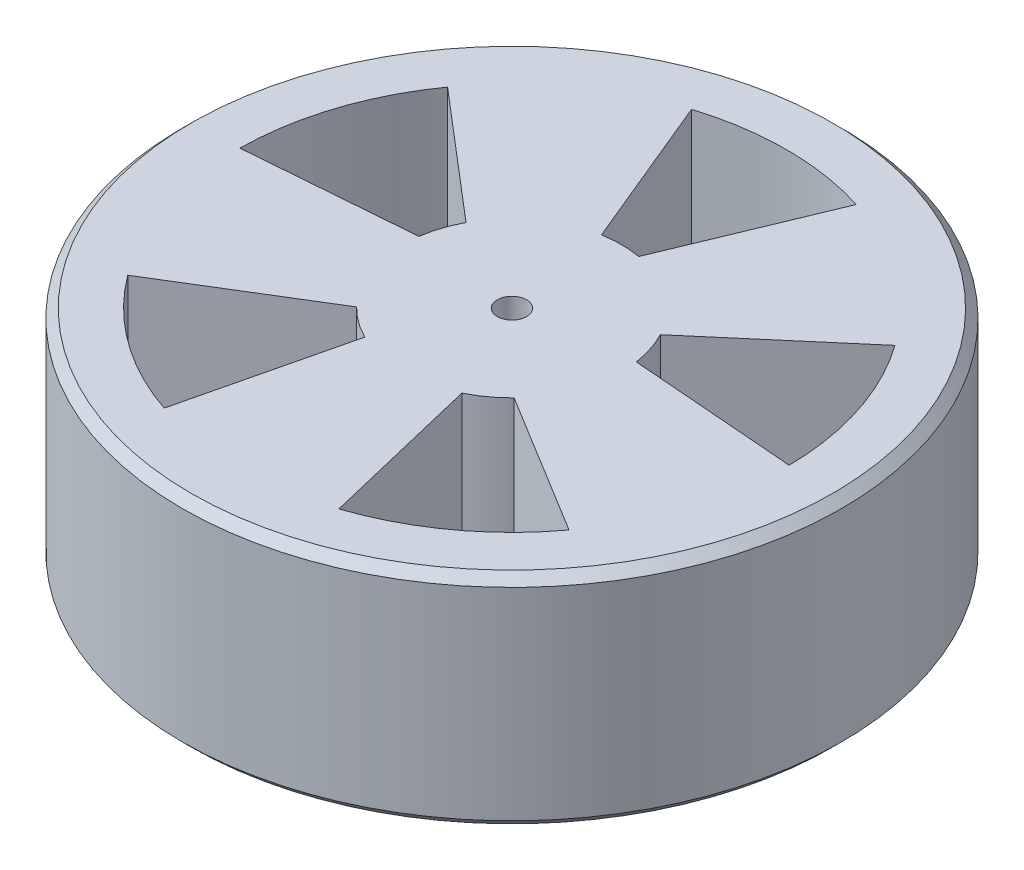
from build123d import *

# Parameters (mm, degrees)
SKETCH1_R               = 76.2
BOSS_EXTRUDE1_DEPTH     = 50.8
CHAMFER1_SIZE           = 2.032
CUT_EXTRUDE2_DEPTH      = 120.1365603
CUT_EXTRUDE2_DEPTH_BACK = 120.1365603
F_1_4_CLEARANCE_HOLE1_D = 6.7564


with BuildPart() as part:
    # Sketch1 → Boss-Extrude1 (new body)
    with BuildSketch(Plane(origin=(0, 0, 0), x_dir=(1, 0, 0), z_dir=(0, 1, 0))):
        Circle(SKETCH1_R)
    extrude(amount=BOSS_EXTRUDE1_DEPTH)

    # Chamfer1
    chamfer1_edges = [part.edges().sort_by_distance(p)[0] for p in [
        (-76.2, 0, 0),
        (-76.2, 50.8, 0),
    ]]
    chamfer(chamfer1_edges, length=CHAMFER1_SIZE)

    # Sketch3 → Cut-Extrude2 (cut, two sides: drawn at the far end of the back side and taken through both)
    with BuildSketch(Plane(origin=(0, 50.8, 0), x_dir=(1, 0, 0), z_dir=(0, 1, 0)).offset(-CUT_EXTRUDE2_DEPTH_BACK)):
        with BuildLine():
            Line((-4.326246991, 25.028855087), (-19.05, 60.57513929))
            ThreePointArc((-19.05, 60.57513929), (0, 63.5), (19.05, 60.57513929))
            Line((19.05, 60.57513929), (4.326246991, 25.028855087))
            ThreePointArc((4.326246991, 25.028855087), (0, 25.4), (-4.326246991, 25.028855087))
        make_face()
        with BuildLine():
            Line((22.466971884, 11.848846964), (51.723607204, 36.836374113))
            ThreePointArc((51.723607204, 36.836374113), (60.392088785, 19.622579143), (63.49715469, 0.601120842))
            Line((63.49715469, 0.601120842), (25.140739568, 3.61983618))
            ThreePointArc((25.140739568, 3.61983618), (24.156835514, 7.849031657), (22.466971884, 11.848846964))
        make_face()
        with BuildLine():
            Line((18.21159924, -17.705864936), (51.016947273, -37.809008066))
            ThreePointArc((51.016947273, -37.809008066), (37.324363521, -51.372579143), (20.193399787, -60.203626178))
            Line((20.193399787, -60.203626178), (11.211584564, -22.791673294))
            ThreePointArc((11.211584564, -22.791673294), (14.929745408, -20.549031657), (18.21159924, -17.705864936))
        make_face()
        with BuildLine():
            Line((-11.211584564, -22.791673294), (-20.193399787, -60.203626178))
            ThreePointArc((-20.193399787, -60.203626178), (-37.324363521, -51.372579143), (-51.016947273, -37.809008066))
            Line((-51.016947273, -37.809008066), (-18.21159924, -17.705864936))
            ThreePointArc((-18.21159924, -17.705864936), (-14.929745408, -20.549031657), (-11.211584564, -22.791673294))
        make_face()
        with BuildLine():
            Line((-25.140739568, 3.61983618), (-63.49715469, 0.601120842))
            ThreePointArc((-63.49715469, 0.601120842), (-60.392088785, 19.622579143), (-51.723607204, 36.836374113))
            Line((-51.723607204, 36.836374113), (-22.466971884, 11.848846964))
            ThreePointArc((-22.466971884, 11.848846964), (-24.156835514, 7.849031657), (-25.140739568, 3.61983618))
        make_face()
    extrude(amount=CUT_EXTRUDE2_DEPTH + CUT_EXTRUDE2_DEPTH_BACK, mode=Mode.SUBTRACT)

    # 1/4 Clearance Hole1 (through all)
    with Locations(Plane(origin=(0, 50.8, 0), x_dir=(1, 0, 0), z_dir=(0, 1, 0))):
        with Locations((0, 0)):
            Hole(F_1_4_CLEARANCE_HOLE1_D / 2)


solid = part.part
